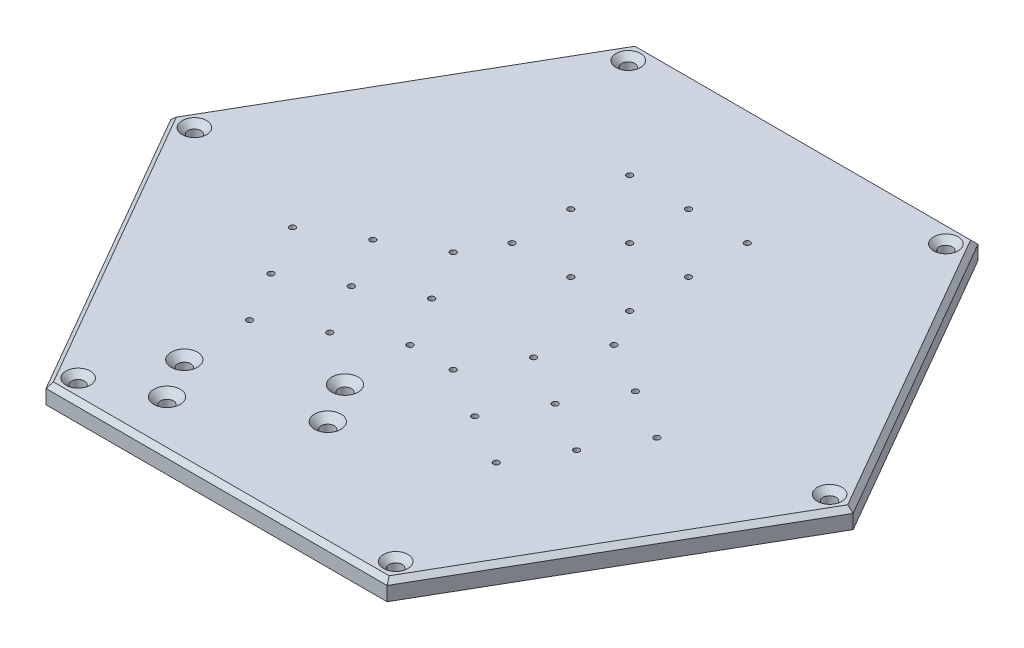
from build123d import *

# Parameters (mm, degrees)
BOSS_EXTRUDE1_DEPTH                             = 8
CSK_FOR_M5_FLAT_HEAD_MACHINE_SCREW2_D           = 5.5
CSK_FOR_M5_FLAT_HEAD_MACHINE_SCREW2_DEPTH       = 10
CSK_FOR_M5_FLAT_HEAD_MACHINE_SCREW2_CSINK_D     = 10.4
CSK_FOR_M5_FLAT_HEAD_MACHINE_SCREW2_CSINK_ANGLE = 90
CSK_FOR_M5_FLAT_HEAD_MACHINE_SCREW2_TIP         = 1.652366702
CHAMFER4_SIZE                                   = 2
M3X0_5_TAPPED_HOLE1_D                           = 2.5
M3X0_5_TAPPED_HOLE1_DEPTH                       = 5
M3X0_5_TAPPED_HOLE1_TIP                         = 0.751075774
CSK_FOR_M5_SFHCS1_D                             = 5.5
CSK_FOR_M5_SFHCS1_DEPTH                         = 10
CSK_FOR_M5_SFHCS1_CSINK_D                       = 11.2
CSK_FOR_M5_SFHCS1_CSINK_ANGLE                   = 90
CSK_FOR_M5_SFHCS1_TIP                           = 1.652366702


with BuildPart() as part:
    # Sketch1 → Boss-Extrude1 (new body)
    with BuildSketch(Plane(origin=(0, 0, 0), x_dir=(1, 0, 0), z_dir=(0, 1, 0))):
        Polygon((72.5, 125.573683549), (-72.5, 125.573683549), (-145, 0), (-72.5, -125.573683549), (72.5, -125.573683549), (145, 0), align=None)
    extrude(amount=BOSS_EXTRUDE1_DEPTH)

    # CSK for M5 Flat Head Machine Screw2
    with Locations(Plane(origin=(0, 8, 0), x_dir=(1, 0, 0), z_dir=(0, 1, 0))):
        with Locations((-135, 0), (-67.5, -116.913429511), (67.5, -116.913429511), (135, 0), (67.5, 116.913429511), (-67.5, 116.913429511)):
            CounterSinkHole(CSK_FOR_M5_FLAT_HEAD_MACHINE_SCREW2_D / 2, CSK_FOR_M5_FLAT_HEAD_MACHINE_SCREW2_CSINK_D / 2, depth=CSK_FOR_M5_FLAT_HEAD_MACHINE_SCREW2_DEPTH, counter_sink_angle=CSK_FOR_M5_FLAT_HEAD_MACHINE_SCREW2_CSINK_ANGLE)
            with Locations((0, 0, -(CSK_FOR_M5_FLAT_HEAD_MACHINE_SCREW2_DEPTH + CSK_FOR_M5_FLAT_HEAD_MACHINE_SCREW2_TIP / 2))):  # 118° drill point
                Cone(0, CSK_FOR_M5_FLAT_HEAD_MACHINE_SCREW2_D / 2, CSK_FOR_M5_FLAT_HEAD_MACHINE_SCREW2_TIP, mode=Mode.SUBTRACT)

    # Chamfer4
    chamfer4_edges = [part.edges().sort_by_distance(p)[0] for p in [
        (0, 8, 125.573683549),
        (108.75, 8, 62.786841774),
        (108.75, 8, -62.786841774),
        (0, 8, -125.573683549),
        (-108.75, 8, -62.786841774),
        (-108.75, 8, 62.786841774),
    ]]
    chamfer(chamfer4_edges, length=CHAMFER4_SIZE)

    # M3x0.5 Tapped Hole1
    with Locations(Plane(origin=(0, 8, 0), x_dir=(1, 0, 0), z_dir=(0, 1, 0))):
        with Locations((34.150635095, 9.150635095), (9.150635095, -34.150635095), (30.801270189, -46.650635095), (55.801270189, -3.349364905), (77.451905284, -15.849364905), (52.451905284, -59.150635095), (64.951905284, -37.5), (43.301270189, -25), (21.650635095, -12.5), (-9.150635095, -34.150635095), (-21.650635095, -12.5), (-34.150635095, 9.150635095), (-55.801270189, -3.349364905), (-43.301270189, -25), (-64.951905284, -37.5), (-77.451905284, -15.849364905), (-30.801270189, -46.650635095), (-25, 25), (-25, 50), (-25, 75), (0, 75), (0, 50), (0, 25), (25, 25), (25, 50), (-52.451905284, -59.150635095), (25, 75)):
            Hole(M3X0_5_TAPPED_HOLE1_D / 2, depth=M3X0_5_TAPPED_HOLE1_DEPTH)
            with Locations((0, 0, -(M3X0_5_TAPPED_HOLE1_DEPTH + M3X0_5_TAPPED_HOLE1_TIP / 2))):  # 118° drill point
                Cone(0, M3X0_5_TAPPED_HOLE1_D / 2, M3X0_5_TAPPED_HOLE1_TIP, mode=Mode.SUBTRACT)

    # CSK for M5 SFHCS1
    with Locations(Plane(origin=(0, 8, 0), x_dir=(1, 0, 0), z_dir=(0, 1, 0))):
        with Locations((1.594210129, -79.908620039), (-8.405789871, -62.588111964), (-51.70706006, -87.588111964), (-41.70706006, -104.908620039)):
            CounterSinkHole(CSK_FOR_M5_SFHCS1_D / 2, CSK_FOR_M5_SFHCS1_CSINK_D / 2, depth=CSK_FOR_M5_SFHCS1_DEPTH, counter_sink_angle=CSK_FOR_M5_SFHCS1_CSINK_ANGLE)
            with Locations((0, 0, -(CSK_FOR_M5_SFHCS1_DEPTH + CSK_FOR_M5_SFHCS1_TIP / 2))):  # 118° drill point
                Cone(0, CSK_FOR_M5_SFHCS1_D / 2, CSK_FOR_M5_SFHCS1_TIP, mode=Mode.SUBTRACT)


solid = part.part
